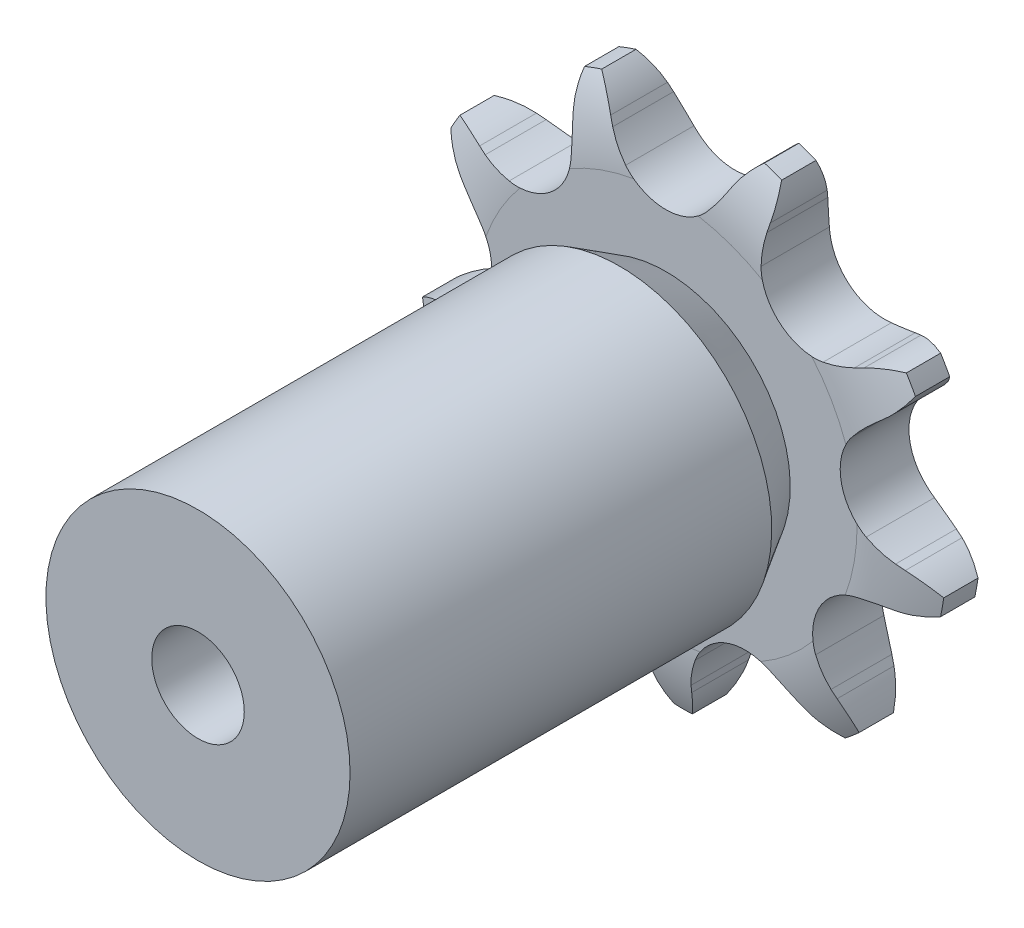
from build123d import *

# Parameters (mm, degrees)
CUT_EXTRUDE1_DEPTH      = 15.261517848
CIRPATTERN1_COUNT       = 9
BOSS_EXTRUDE1_START     = 1.3
SKETCH2_R               = 5.75
BOSS_EXTRUDE1_DEPTH     = 7.4
CUT_EXTRUDE2_DEPTH      = 17.591034702
CUT_EXTRUDE2_DEPTH_BACK = 17.591034702
SKETCH3_R               = 2.5
SKETCH4_W               = 1.95
SKETCH4_H               = 5.371019058
CUT_EXTRUDE3_DEPTH      = 17.591034702
CUT_EXTRUDE3_DEPTH_BACK = 17.591034702
SKETCH5_OUTSIDE_W       = 27.798
SKETCH5_OUTSIDE_H       = 27.5
SKETCH5_OUTSIDE_R       = 9.95
SKETCH6_R               = 5.75
SKETCH6_R_2             = 2.5
BOSS_EXTRUDE2_DEPTH     = 10.79
BOSS_EXTRUDE3_START     = -1.3
SKETCH7_R               = 2.5
SKETCH7_R_2             = 1.75
BOSS_EXTRUDE3_DEPTH     = 20.29
CHAMFER1_SIZE           = 2
CHAMFER1_SIZE_2         = 1.2


with BuildPart() as part:
    # Sketch1 → Revolve1 (revolve)
    with BuildSketch(Plane(origin=(0, 0, 0), x_dir=(0, 0, -1), z_dir=(1, 0, 0))):
        with BuildLine():
            Line((1.3, 0), (-1.3, 0))
            Line((-1.3, 0), (-1.3, 7.229960036))
            ThreePointArc((-1.3, 7.229960036), (-1.122370651, 8.679097711), (-0.6, 10.042432258))
            Line((-0.6, 10.042432258), (0.6, 10.042432258))
            ThreePointArc((0.6, 10.042432258), (1.122370651, 8.679097711), (1.3, 7.229960036))
            Line((1.3, 7.229960036), (1.3, 0))
        make_face()
    revolve(axis=Axis((0, 0, -1.3), (0, 0, 1)))

    # Sketch0 → Cut-Extrude1 (cut, symmetric)
    with BuildSketch(Plane.XY):
        with BuildLine():
            Line((5.098468609, -7.244145344), (4.862482466, -7.045348332))
            ThreePointArc((4.862482466, -7.045348332), (4.432831877, -6.719619585), (3.972029017, -6.439691789))
            ThreePointArc((3.972029017, -6.439691789), (2.299508544, -6.317847802), (1.096603336, -7.486261148))
            ThreePointArc((1.096603336, -7.486261148), (0.923541984, -7.996896649), (0.803784941, -8.522593421))
            Line((0.803784941, -8.522593421), (0.750793323, -8.826569736))
            ThreePointArc((0.750793323, -8.826569736), (-0.832851059, -11.14866988), (-3.623218265, -11.486204271))
            ThreePointArc((-3.623218265, -11.486204271), (4.11932842, -11.317761816), (10.158736006, -6.469983147))
            ThreePointArc((10.158736006, -6.469983147), (7.804227789, -8.005030268), (5.098468609, -7.244145344))
        make_face()
    cut_extrude1 = extrude(amount=CUT_EXTRUDE1_DEPTH, both=True, mode=Mode.SUBTRACT)

    # CirPattern1: Cut-Extrude1 ×9 about axis
    cirpattern1_axis = Axis((0, 0, 0), (0, 0, 1))
    for i in range(1, CIRPATTERN1_COUNT):
        add(cut_extrude1.rotate(cirpattern1_axis, i * 360 / CIRPATTERN1_COUNT), mode=Mode.SUBTRACT)

    # Sketch2 → Boss-Extrude1 (add)
    with BuildSketch(Plane.XY.offset(BOSS_EXTRUDE1_START)):
        with Locations(Location((0, 0, 0), (0, 0, 270))):
            Circle(SKETCH2_R)
    extrude(amount=BOSS_EXTRUDE1_DEPTH)

    # Sketch3 → Cut-Extrude2 (cut, two sides: drawn at the far end of the back side and taken through both)
    with BuildSketch(Plane.XY.offset(-CUT_EXTRUDE2_DEPTH_BACK)):
        Circle(SKETCH3_R)
    extrude(amount=CUT_EXTRUDE2_DEPTH + CUT_EXTRUDE2_DEPTH_BACK, mode=Mode.SUBTRACT)

    # Sketch4 → Cut-Revolve1 (revolve, cut)
    with BuildSketch(Plane(origin=(0, 0, 0), x_dir=(0, 0, -1), z_dir=(1, 0, 0))):
        Polygon((-8.7, 5.75), (-8.7, 5.25), (-8.2, 5.75), align=None)
        with Locations((-2.275, 7.356922729)):
            Rectangle(SKETCH4_W, SKETCH4_H)
    revolve(axis=Axis((0, 0, -1.3), (0, 0, 1)), mode=Mode.SUBTRACT)

    # Sketch5 outside → Cut-Extrude3 (cut, two sides: drawn at the far end of the back side and taken through both)
    with BuildSketch(Plane.XY.offset(-CUT_EXTRUDE3_DEPTH_BACK)):
        with Locations((0, -0.255)):
            Rectangle(SKETCH5_OUTSIDE_W, SKETCH5_OUTSIDE_H)
        Circle(SKETCH5_OUTSIDE_R, mode=Mode.SUBTRACT)
    extrude(amount=CUT_EXTRUDE3_DEPTH + CUT_EXTRUDE3_DEPTH_BACK, mode=Mode.SUBTRACT)

    # Sketch6 → Boss-Extrude2 (add)
    with BuildSketch(Plane.XY.offset(8.2)):
        with Locations(Location((0, 0, 0), (0, 0, 270))):
            Circle(SKETCH6_R)
        Circle(SKETCH6_R_2, mode=Mode.SUBTRACT)
    extrude(amount=BOSS_EXTRUDE2_DEPTH)

    # Sketch7 → Boss-Extrude3 (add)
    with BuildSketch(Plane.XY.offset(BOSS_EXTRUDE3_START)):
        Circle(SKETCH7_R)
        with Locations(Location((0, 0, 0), (0, 0, 90))):
            Circle(SKETCH7_R_2, mode=Mode.SUBTRACT)
    extrude(amount=BOSS_EXTRUDE3_DEPTH)

    # Chamfer1
    # the kernel refuses this chamfer: 2, 1.2 mm, written as the material it adds along each edge
    with BuildSketch(Plane(origin=(0, 0, 3.25), x_dir=(0, 1, 0), z_dir=(1, 0, 0))) as chamfer1_piece_1_section:
        Polygon((4.6714132, -CHAMFER1_SIZE), (4.6714132 + CHAMFER1_SIZE_2, 0), (4.6714132, 0), align=None)
    chamfer1_piece_1 = revolve(axis=Axis((0, 0, 3.25), (0, 0, 1)), mode=Mode.PRIVATE)
    chamfer1_piece_1 = chamfer1_piece_1 & Plane(origin=(0, 0, 2.191084366), x_dir=(0, -1, 0), z_dir=(0, 0, -1)) * Cylinder(5.75, 24, mode=Mode.PRIVATE)
    add(chamfer1_piece_1)


solid = part.part
